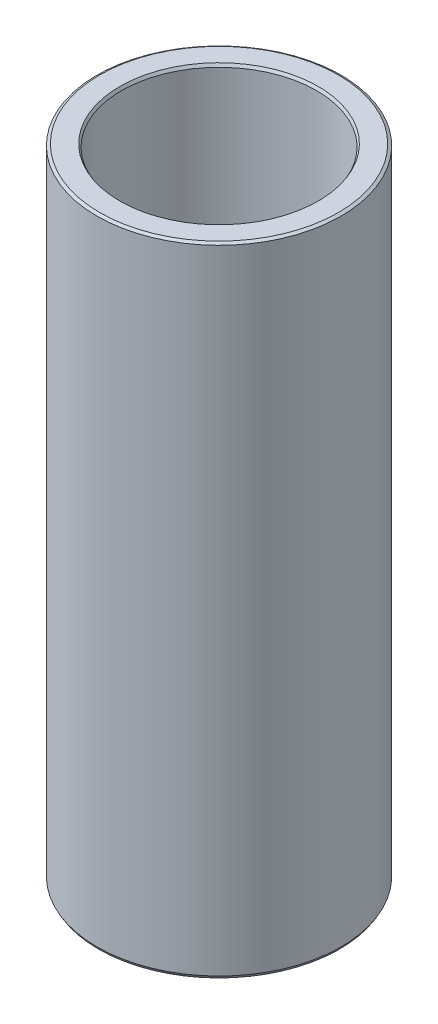
from build123d import *
from OCP.BRepFilletAPI import BRepFilletAPI_MakeChamfer

# Parameters (mm, degrees)
SKETCH1_R           = 50
BOSS_EXTRUDE1_DEPTH = 260.991136871
SKETCH2_R           = 39.983083135
CUT_EXTRUDE1_DEPTH  = 271.400394832
CHAMFER1_SIZE       = 0.664662033
CHAMFER1_SIZE2      = 1.151228412


with BuildPart() as part:
    # Sketch1 → Boss-Extrude1 (new body)
    with BuildSketch(Plane(origin=(0, 0, 0), x_dir=(1, 0, 0), z_dir=(0, 1, 0))):
        Circle(SKETCH1_R)
    extrude(amount=BOSS_EXTRUDE1_DEPTH)

    # Sketch2 → Cut-Extrude1 (cut, through all)
    with BuildSketch(Plane(origin=(0, 0, 0), x_dir=(1, 0, 0), z_dir=(0, 1, 0))):
        Circle(SKETCH2_R)
    extrude(amount=CUT_EXTRUDE1_DEPTH, mode=Mode.SUBTRACT)

    # Chamfer1: one chamfer whose edges measure the first distance from different faces: ONE call of the kernel's chamfer builder (chamfer() names one face for all edges)
    chamfer1_edges_1 = [part.edges().sort_by_distance(p)[0] for p in [
        (-39.983083135, 260.991136871, 0),
    ]]
    chamfer1_side_1 = [part.faces().sort_by_distance(p)[0] for p in [
        (-48.585786438, 260.991136871, 0),
    ]]
    chamfer1_edges_2 = [part.edges().sort_by_distance(p)[0] for p in [
        (-39.983083135, 0, 0),
    ]]
    chamfer1_side_2 = [part.faces().sort_by_distance(p)[0] for p in [
        (-39.983083135, 130.495568436, 0),
    ]]
    chamfer1_edges_3 = [part.edges().sort_by_distance(p)[0] for p in [
        (-50, 0, 0),
    ]]
    chamfer1_side_3 = [part.faces().sort_by_distance(p)[0] for p in [
        (-48.585786438, 0, 0),
    ]]
    chamfer1_edges_4 = [part.edges().sort_by_distance(p)[0] for p in [
        (-50, 260.991136871, 0),
    ]]
    chamfer1_side_4 = [part.faces().sort_by_distance(p)[0] for p in [
        (-50, 130.495568436, 0),
    ]]
    chamfer1 = BRepFilletAPI_MakeChamfer(part.part.solid().wrapped)
    for e in chamfer1_edges_1:
        chamfer1.Add(CHAMFER1_SIZE, CHAMFER1_SIZE2, e.wrapped, chamfer1_side_1[0].wrapped)  # the first distance lies on this face
    for e in chamfer1_edges_2:
        chamfer1.Add(CHAMFER1_SIZE, CHAMFER1_SIZE2, e.wrapped, chamfer1_side_2[0].wrapped)  # the first distance lies on this face
    for e in chamfer1_edges_3:
        chamfer1.Add(CHAMFER1_SIZE, CHAMFER1_SIZE2, e.wrapped, chamfer1_side_3[0].wrapped)  # the first distance lies on this face
    for e in chamfer1_edges_4:
        chamfer1.Add(CHAMFER1_SIZE, CHAMFER1_SIZE2, e.wrapped, chamfer1_side_4[0].wrapped)  # the first distance lies on this face
    add(Compound.cast(chamfer1.Shape()), mode=Mode.REPLACE)


solid = part.part
